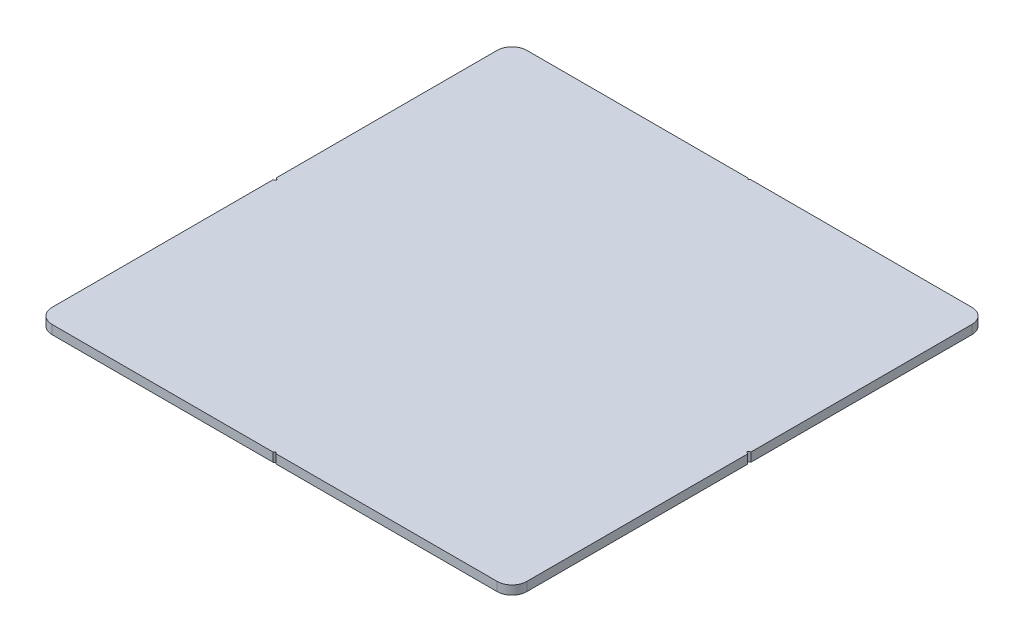
from build123d import *

# Parameters (mm, degrees)
EXTRUDE_1_DEPTH     = 6
CUT_EXTRUDE_1_DEPTH = 227.353705514


with BuildPart() as part:
    # Эскиз1 → Бобышка-Вытянуть1 (new body)
    with BuildSketch(Plane(origin=(0, 0, 0), x_dir=(1, 0, 0), z_dir=(0, 1, 0))):
        with BuildLine():
            Line((-150, -160), (150, -160))
            ThreePointArc((150, -160), (157.071067812, -157.071067812), (160, -150))
            Line((160, -150), (160, 150))
            ThreePointArc((160, 150), (157.071067812, 157.071067812), (150, 160))
            Line((150, 160), (-150, 160))
            ThreePointArc((-150, 160), (-157.071067812, 157.071067812), (-160, 150))
            Line((-160, 150), (-160, -150))
            ThreePointArc((-160, -150), (-157.071067812, -157.071067812), (-150, -160))
        make_face()
    extrude(amount=EXTRUDE_1_DEPTH)

    # Эскиз2 → Вырез-Вытянуть1 (cut, through all)
    with BuildSketch(Plane(origin=(0, 6, 0), x_dir=(1, 0, 0), z_dir=(0, 1, 0))):
        Polygon((-158.366315253, 0), (-160, 1.26922049), (-160, -1.275236171), align=None)
        Polygon((160, -1.275236171), (158.366315253, 0), (160, 1.26922049), align=None)
        Polygon((0, 159.059563805), (0.940436195, 160), (-0.940436195, 160), align=None)
        Polygon((-0.940436195, -160), (0, -159.059563805), (0.940436195, -160), align=None)
    extrude(amount=-CUT_EXTRUDE_1_DEPTH, mode=Mode.SUBTRACT)


solid = part.part
